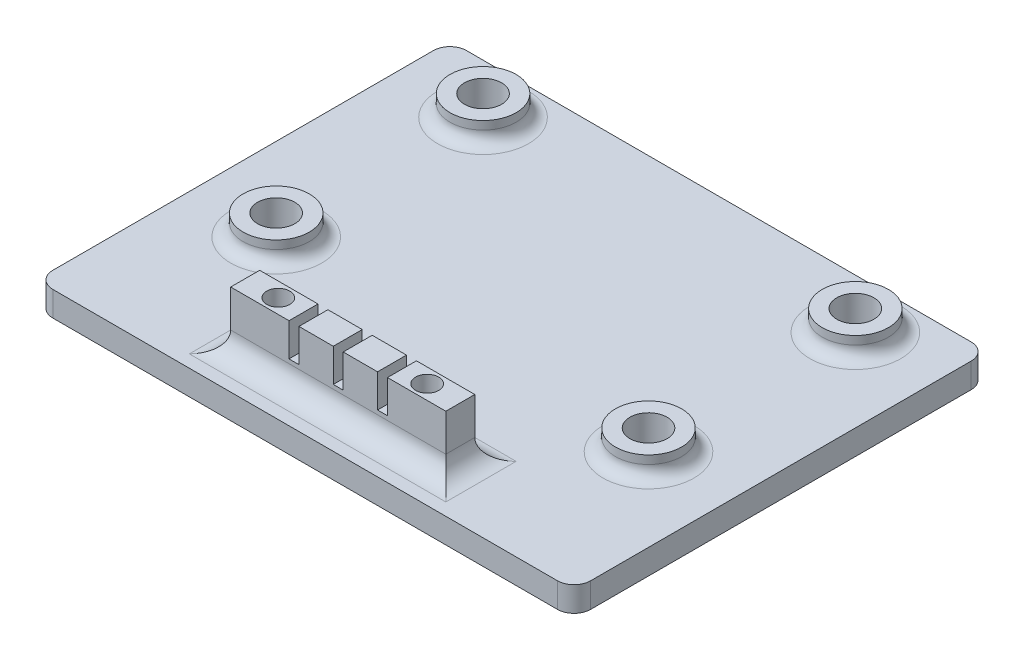
from build123d import *

# Parameters (mm, degrees)
SKIZZE1_W                                           = 65
SKIZZE1_H                                           = 50
AUFSATZ_LINEAR_AUSTRAGEN1_DEPTH                     = 3
VERRUNDUNG1_R                                       = 2
SKIZZE10_R                                          = 4
AUFSATZ_LINEAR_AUSTRAGEN4_DEPTH                     = 2.5
STIRNSENKUNG_F_R_M3_SENKSCHRAUBE_KOPF_B_D           = 4.5
STIRNSENKUNG_F_R_M3_SENKSCHRAUBE_KOPF_B_CBORE_D     = 4.9
STIRNSENKUNG_F_R_M3_SENKSCHRAUBE_KOPF_B_CBORE_DEPTH = 0.3
SKIZZE8_W                                           = 3.5
SKIZZE8_H                                           = 7
AUFSATZ_LINEAR_AUSTRAGEN3_DEPTH                     = 13
STIRNSENKUNG_F_R_M3_SENKSCHRAUBE_KO_2_D             = 2.8
STIRNSENKUNG_F_R_M3_SENKSCHRAUBE_KO_2_CBORE_D       = 6
STIRNSENKUNG_F_R_M3_SENKSCHRAUBE_KO_2_CBORE_DEPTH   = 6
SKIZZE7_W                                           = 1.2
SKIZZE7_H                                           = 3.5
SCHNITT_LINEAR_AUSTRAGEN1_DEPTH                     = 4
VERRUNDUNG2_R                                       = 1.5
VERRUNDUNG5_R                                       = 2.5
VERRUNDUNG6_R                                       = 2.5


with BuildPart() as part:
    # Skizze1 → Aufsatz-Linear austragen1 (new body)
    with BuildSketch(Plane(origin=(0, 0, 0), x_dir=(1, 0, 0), z_dir=(0, 1, 0))):
        with Locations((0, 25)):
            Rectangle(SKIZZE1_W, SKIZZE1_H)
    extrude(amount=AUFSATZ_LINEAR_AUSTRAGEN1_DEPTH)

    # Verrundung1
    verrundung1_edges = [part.edges().sort_by_distance(p)[0] for p in [
        (-32.5, 1.5, -50),
        (32.5, 1.5, -50),
        (32.5, 1.5, 0),
        (-32.5, 1.5, 0),
    ]]
    fillet(verrundung1_edges, radius=VERRUNDUNG1_R)

    # Skizze10 → Aufsatz-Linear austragen4 (add)
    with BuildSketch(Plane(origin=(0, 3, 0), x_dir=(1, 0, 0), z_dir=(0, 1, 0))):
        with Locations((-22.5, 44)):
            Circle(SKIZZE10_R)
        with Locations((-22.5, 19)):
            Circle(SKIZZE10_R)
        with Locations((22.5, 44)):
            Circle(SKIZZE10_R)
        with Locations((22.5, 19)):
            Circle(SKIZZE10_R)
    extrude(amount=AUFSATZ_LINEAR_AUSTRAGEN4_DEPTH)

    # Stirnsenkung f_r M3 Senkschraube _Kopf B (through all)
    with Locations(Plane.XZ):
        with Locations((-22.5, -19), (22.5, -44), (-22.5, -44), (22.5, -19)):
            CounterBoreHole(STIRNSENKUNG_F_R_M3_SENKSCHRAUBE_KOPF_B_D / 2, STIRNSENKUNG_F_R_M3_SENKSCHRAUBE_KOPF_B_CBORE_D / 2, STIRNSENKUNG_F_R_M3_SENKSCHRAUBE_KOPF_B_CBORE_DEPTH)

    # Skizze8 → Aufsatz-Linear austragen3 (add, symmetric)
    with BuildSketch(Plane(origin=(0, 0, 0), x_dir=(0, 0, -1), z_dir=(1, 0, 0))):
        with Locations((5.75, 6.5)):
            Rectangle(SKIZZE8_W, SKIZZE8_H)
    extrude(amount=AUFSATZ_LINEAR_AUSTRAGEN3_DEPTH, both=True)

    # Stirnsenkung f_r M3 Senkschraube _Ko 2 (through all)
    with Locations(Plane(origin=(0, -5, 1.917691722), x_dir=(-1, 0, 0), z_dir=(0, -1, 0))):
        with Locations((9, 7.667691722), (-9, 7.667691722)):
            CounterBoreHole(STIRNSENKUNG_F_R_M3_SENKSCHRAUBE_KO_2_D / 2, STIRNSENKUNG_F_R_M3_SENKSCHRAUBE_KO_2_CBORE_D / 2, STIRNSENKUNG_F_R_M3_SENKSCHRAUBE_KO_2_CBORE_DEPTH)

    # Skizze7 → Schnitt-Linear austragen1 (cut)
    with BuildSketch(Plane(origin=(0, 10, 0), x_dir=(1, 0, 0), z_dir=(0, 1, 0))):
        with Locations((0, 5.75)):
            Rectangle(SKIZZE7_W, SKIZZE7_H)
        with Locations((-5.35, 5.75)):
            Rectangle(SKIZZE7_W, SKIZZE7_H)
        with Locations((5.35, 5.75)):
            Rectangle(SKIZZE7_W, SKIZZE7_H)
    extrude(amount=-SCHNITT_LINEAR_AUSTRAGEN1_DEPTH, mode=Mode.SUBTRACT)

    # Verrundung2
    verrundung2_edges = [part.edges().sort_by_distance(p)[0] for p in [
        (-26.5, 3, -44),
        (-26.5, 3, -19),
        (18.5, 3, -44),
        (18.5, 3, -19),
    ]]
    fillet(verrundung2_edges, radius=VERRUNDUNG2_R)

    # Verrundung5
    verrundung5_edges = [part.edges().sort_by_distance(p)[0] for p in [
        (-13, 3, -5.75),
        (13, 3, -5.75),
        (0, 3, -4),
    ]]
    fillet(verrundung5_edges, radius=VERRUNDUNG5_R)

    # Verrundung6
    verrundung6_edges = [part.edges().sort_by_distance(p)[0] for p in [
        (0, 3, -7.5),
    ]]
    fillet(verrundung6_edges, radius=VERRUNDUNG6_R)


solid = part.part
